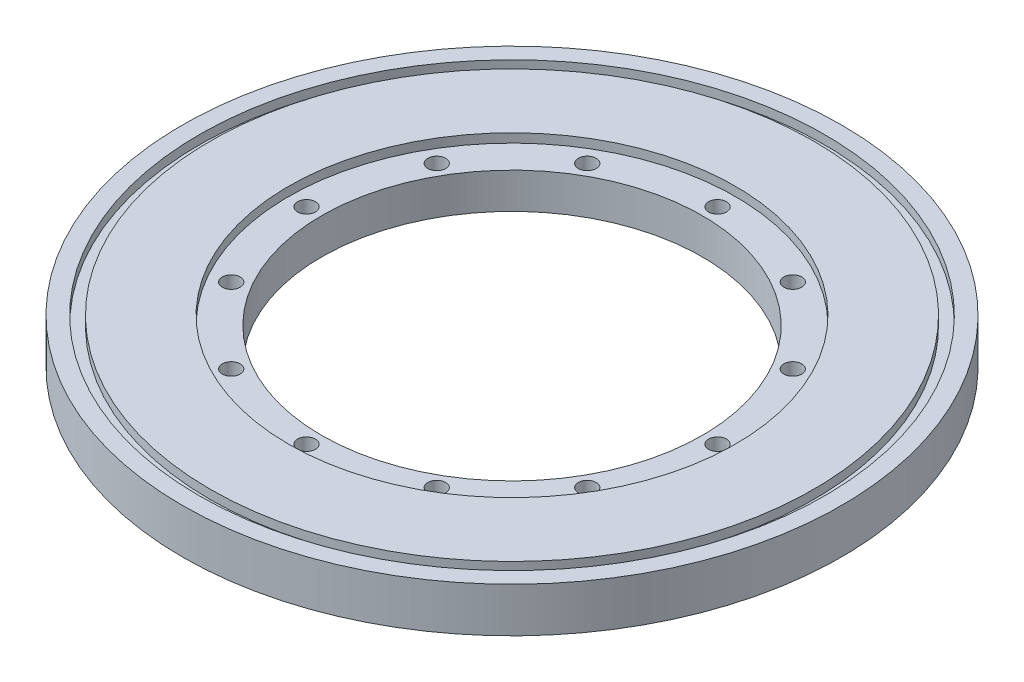
from build123d import *

# Parameters (mm, degrees)
SKETCH1_R           = 93.6625
BOSS_EXTRUDE1_DEPTH = 12.7
SKETCH2_R           = 54.102
CUT_EXTRUDE1_DEPTH  = 134.066215895
SKETCH3_R           = 63.5
CUT_EXTRUDE2_DEPTH  = 2.54
SKETCH4_R           = 2.54
CUT_EXTRUDE3_DEPTH  = 134.066215895
CIRPATTERN1_COUNT   = 12
SKETCH5_R           = 88.9
SKETCH5_R_2         = 85.725
CUT_EXTRUDE4_DEPTH  = 2.54


with BuildPart() as part:
    # Sketch1 → Boss-Extrude1 (new body)
    with BuildSketch(Plane(origin=(0, 0, 0), x_dir=(1, 0, 0), z_dir=(0, 1, 0))):
        Circle(SKETCH1_R)
    extrude(amount=BOSS_EXTRUDE1_DEPTH)

    # Sketch2 → Cut-Extrude1 (cut, through all)
    with BuildSketch(Plane(origin=(0, 12.7, 0), x_dir=(1, 0, 0), z_dir=(0, 1, 0))):
        Circle(SKETCH2_R)
    extrude(amount=-CUT_EXTRUDE1_DEPTH, mode=Mode.SUBTRACT)

    # Sketch3 → Cut-Extrude2 (cut)
    with BuildSketch(Plane(origin=(0, 12.7, 0), x_dir=(1, 0, 0), z_dir=(0, 1, 0))):
        Circle(SKETCH3_R)
    extrude(amount=-CUT_EXTRUDE2_DEPTH, mode=Mode.SUBTRACT)

    # Sketch4 → Cut-Extrude3 (cut, through all)
    with BuildSketch(Plane(origin=(0, 12.7, 0), x_dir=(1, 0, 0), z_dir=(0, 1, 0))):
        with Locations((0, 58.42)):
            Circle(SKETCH4_R)
    cut_extrude3 = extrude(amount=-CUT_EXTRUDE3_DEPTH, mode=Mode.SUBTRACT)

    # CirPattern1: Cut-Extrude3 ×12 about axis
    cirpattern1_axis = Axis((0, 12.7, 0), (0, 1, 0))
    for i in range(1, CIRPATTERN1_COUNT):
        add(cut_extrude3.rotate(cirpattern1_axis, i * 360 / CIRPATTERN1_COUNT), mode=Mode.SUBTRACT)

    # Sketch5 → Cut-Extrude4 (cut)
    with BuildSketch(Plane(origin=(0, 12.7, 0), x_dir=(1, 0, 0), z_dir=(0, 1, 0))):
        Circle(SKETCH5_R)
        Circle(SKETCH5_R_2, mode=Mode.SUBTRACT)
    extrude(amount=-CUT_EXTRUDE4_DEPTH, mode=Mode.SUBTRACT)


solid = part.part
